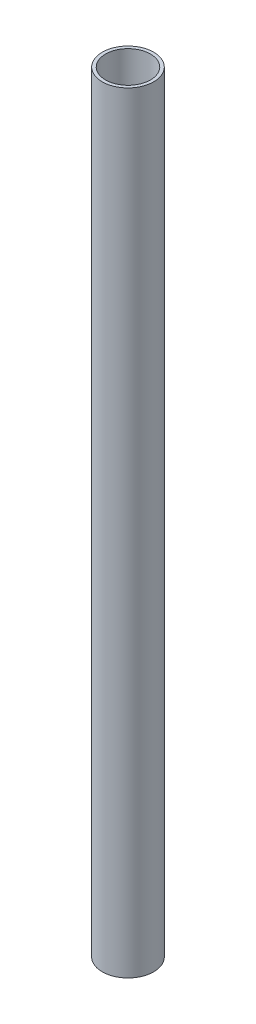
from build123d import *

# Parameters (mm, degrees)
SKETCH1_R           = 50.8
SKETCH1_R_2         = 44.45
BOSS_EXTRUDE1_DEPTH = 1524


with BuildPart() as part:
    # Sketch1 → Boss-Extrude1 (new body)
    with BuildSketch(Plane(origin=(0, 0, 0), x_dir=(1, 0, 0), z_dir=(0, 1, 0))):
        Circle(SKETCH1_R)
        Circle(SKETCH1_R_2, mode=Mode.SUBTRACT)
    extrude(amount=BOSS_EXTRUDE1_DEPTH)


solid = part.part
